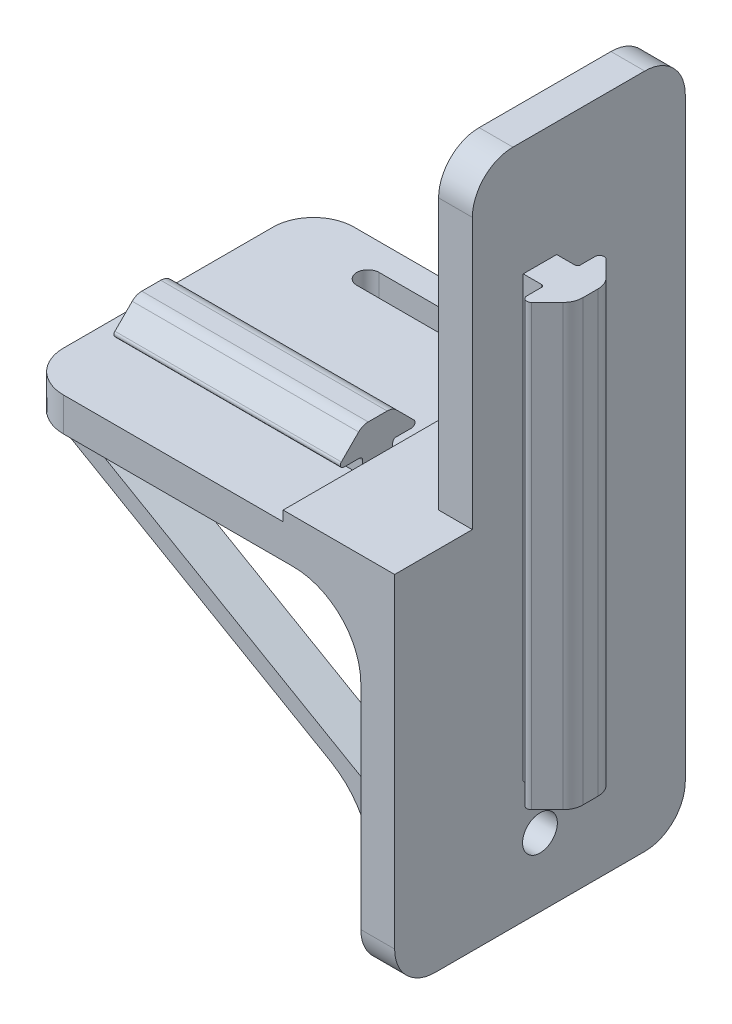
from build123d import *

# Parameters (mm, degrees)
BOSS_EXTRUDE5_DEPTH  = 50
SKETCH11_W           = 43
SKETCH11_H           = 100
BOSS_EXTRUDE6_DEPTH  = 5
BOSS_EXTRUDE8_DEPTH  = 55
SKETCH13_W           = 11.5
SKETCH13_H           = 47.5
CUT_EXTRUDE1_DEPTH   = 55
BOSS_EXTRUDE9_DEPTH  = 6
FILLET7_R            = 12
FILLET7_OF_MIRROR1_R = 12
FILLET8_R            = 6
BOSS_EXTRUDE10_START = 8
BOSS_EXTRUDE10_DEPTH = 8
FILLET12_R           = 10
BOSS_EXTRUDE11_DEPTH = 57
SKETCH16_R           = 2.575
CUT_EXTRUDE2_DEPTH   = 10
SKETCH17_W           = 27.480150942
SKETCH17_H           = 1.5
BOSS_EXTRUDE12_DEPTH = 11.5
SKETCH18_W           = 11.5
SKETCH18_H           = 1.5
BOSS_EXTRUDE13_DEPTH = 5
BOSS_EXTRUDE15_START = -5
BOSS_EXTRUDE15_DEPTH = 33.5
CUT_EXTRUDE3_DEPTH   = 6


with BuildPart() as part:
    # Sketch9 → Boss-Extrude5 (new body)
    with BuildSketch(Plane(origin=(0, 245, 0), x_dir=(1, 0, 0), z_dir=(0, 1, 0))):
        with BuildLine():
            Line((389.629800237, -111.599739584), (387.629800237, -111.599739584))
            Line((387.629800237, -111.599739584), (387.629800237, -106.649739584))
            Line((387.629800237, -106.649739584), (389.629800237, -106.649739584))
            Line((389.629800237, -106.649739584), (390.329799474, -106.649739584))
            ThreePointArc((390.329799474, -106.649739584), (390.605571069, -106.535511279), (390.719799474, -106.259739725))
            Line((390.719799474, -106.259739725), (390.719800256, -104.090618139))
            ThreePointArc((390.719800256, -104.090618139), (391.145748802, -103.453141463), (391.897703935, -103.602714709))
            Line((391.897703935, -103.602714709), (394.237480965, -105.942491739))
            ThreePointArc((394.237480965, -105.942491739), (394.868289671, -106.886563682), (395.089800232, -108.000172467))
            Line((395.089800232, -108.000172467), (395.089800237, -110.249306685))
            ThreePointArc((395.089800237, -110.249306685), (394.868289678, -111.362915477), (394.23748097, -112.306987424))
            Line((394.23748097, -112.306987424), (391.897703941, -114.646764454))
            ThreePointArc((391.897703941, -114.646764454), (391.145748809, -114.7963377), (390.719800262, -114.158861025))
            Line((390.719800262, -114.158861025), (390.719799474, -111.989739443))
            ThreePointArc((390.719799474, -111.989739443), (390.605571069, -111.71396789), (390.329799474, -111.599739584))
            Line((390.329799474, -111.599739584), (389.629800237, -111.599739584))
        make_face()
    extrude(amount=-BOSS_EXTRUDE5_DEPTH)

    # Sketch11 → Boss-Extrude6 (add)
    with BuildSketch(Plane.ZY.offset(-387.629800242)):
        with Locations((109.124739584, 220)):
            Rectangle(SKETCH11_W, SKETCH11_H)
    extrude(amount=BOSS_EXTRUDE6_DEPTH)

    # Sketch12 → Boss-Extrude8 (add)
    with BuildSketch(Plane.ZY.offset(-387.629800242)):
        Polygon((130.624739584, 222.5), (89.124739584, 222.5), (87.624739584, 222.5), (87.624739584, 217.5), (89.124739584, 217.5), (130.624739584, 217.5), align=None)
    extrude(amount=BOSS_EXTRUDE8_DEPTH)

    # Sketch13 → Cut-Extrude1 (cut)
    with BuildSketch(Plane.ZY.offset(-387.629800242)):
        with Locations((124.874739584, 246.25)):
            Rectangle(SKETCH13_W, SKETCH13_H)
    extrude(amount=CUT_EXTRUDE1_DEPTH, mode=Mode.SUBTRACT)

    # Sketch15 → Boss-Extrude9 (add)
    with BuildSketch(Plane.XY.offset(129.124739584)):
        Polygon((335.629800242, 217.5), (382.629800242, 190.364537348), (382.629800242, 193.251288694), (340.629800242, 217.5), align=None)
    boss_extrude9 = extrude(amount=-BOSS_EXTRUDE9_DEPTH)

    # Fillet7
    # the kernel refuses this fillet: 12 mm, written as the material it adds along each edge
    with BuildSketch(Plane(origin=(335.629800242, 217.5, 129.124739584), x_dir=(-1, 0, 0), z_dir=(0, 0, -1))) as fillet7_piece_1:
        with BuildLine():
            CenterArc((3.218847051, -11.998004249), FILLET7_R, 91.044975628, 28.955024372)
            Line((-2.781152949, -1.605699404), (-2.901152949, -1.397853307))
            Line((-2.901152949, -1.397853307), (-0.12, 0.207846097))
            Line((-0.12, 0.207846097), (0, 0.24))
            ThreePointArc((0, 0.24), (1.5, 0.24), (2.995623059, 0.239960085))
            Line((2.995623059, 0.239960085), (3, 0))
        make_face()
    extrude(amount=6)
    with BuildSketch(Plane(origin=(382.629800242, 190.364537348, 129.124739584), x_dir=(0, -1, 0), z_dir=(0, 0, -1))) as fillet7_piece_2:
        with BuildLine():
            CenterArc((FILLET7_R * 0.57735026919, FILLET7_R), FILLET7_R, 210, 60)
            Line((-FILLET7_R * 0.288675134595, FILLET7_R * 0.5), (-FILLET7_R * 0.305995642671, FILLET7_R * 0.49))
            Line((-FILLET7_R * 0.305995642671, FILLET7_R * 0.49), (-FILLET7_R * 0.0115470053838, -FILLET7_R * 0.02))
            Line((-FILLET7_R * 0.0115470053838, -FILLET7_R * 0.02), (FILLET7_R * 0.57735026919, -FILLET7_R * 0.02))
            Line((FILLET7_R * 0.57735026919, -FILLET7_R * 0.02), (FILLET7_R * 0.57735026919, 0))
        make_face()
    extrude(amount=6)

    # Mirror1: Boss-Extrude9 across plane
    add(boss_extrude9.mirror(Plane.XY.offset(110.624739584)))

    # Fillet7 of Mirror1
    # the kernel refuses this fillet: 12 mm, written as the material it adds along each edge
    with BuildSketch(Plane(origin=(335.629800242, 217.5, 92.124739584), x_dir=(-1, 0, 0), z_dir=(0, 0, 1))) as fillet7_of_mirror1_piece_1:
        with BuildLine():
            CenterArc((3.218847051, 11.998004249), FILLET7_OF_MIRROR1_R, 240, 28.955024372)
            Line((-2.781152949, 1.605699404), (-2.901152949, 1.397853307))
            Line((-2.901152949, 1.397853307), (-0.12, -0.207846097))
            Line((-0.12, -0.207846097), (0, -0.24))
            ThreePointArc((0, -0.24), (1.5, -0.24), (2.995623059, -0.239960085))
            Line((2.995623059, -0.239960085), (3, 0))
        make_face()
    extrude(amount=6)
    with BuildSketch(Plane(origin=(382.629800242, 190.364537348, 92.124739584), x_dir=(0, -1, 0), z_dir=(0, 0, 1))) as fillet7_of_mirror1_piece_2:
        with BuildLine():
            CenterArc((FILLET7_OF_MIRROR1_R * 0.57735026919, -FILLET7_OF_MIRROR1_R), FILLET7_OF_MIRROR1_R, 90, 60)
            Line((-FILLET7_OF_MIRROR1_R * 0.288675134595, -FILLET7_OF_MIRROR1_R * 0.5), (-FILLET7_OF_MIRROR1_R * 0.305995642671, -FILLET7_OF_MIRROR1_R * 0.49))
            Line((-FILLET7_OF_MIRROR1_R * 0.305995642671, -FILLET7_OF_MIRROR1_R * 0.49), (-FILLET7_OF_MIRROR1_R * 0.0115470053838, FILLET7_OF_MIRROR1_R * 0.02))
            Line((-FILLET7_OF_MIRROR1_R * 0.0115470053838, FILLET7_OF_MIRROR1_R * 0.02), (FILLET7_OF_MIRROR1_R * 0.57735026919, FILLET7_OF_MIRROR1_R * 0.02))
            Line((FILLET7_OF_MIRROR1_R * 0.57735026919, FILLET7_OF_MIRROR1_R * 0.02), (FILLET7_OF_MIRROR1_R * 0.57735026919, 0))
        make_face()
    extrude(amount=6)

    # Fillet8
    # the kernel refuses this fillet: 6 mm, written as the material it takes off along each edge
    with BuildSketch(Plane(origin=(402.629800242, 270, 87.624739584), x_dir=(0, 0, 1), z_dir=(-1, 0, 0)), Plane(origin=(332.629800242, 237.5, 87.624739584), x_dir=(0, 0, 1), z_dir=(0, -1, 0)), Plane(origin=(402.629800242, 270, 119.124739584), x_dir=(0, -1, 0), z_dir=(-1, 0, 0))) as fillet8_piece_1:
        with BuildLine():
            CenterArc((FILLET8_R, -FILLET8_R), FILLET8_R, 90, 90)
            Line((0, -FILLET8_R), (0, 0))
            Line((0, 0), (FILLET8_R, 0))
        make_face()
    extrude(amount=35, mode=Mode.SUBTRACT)
    with BuildSketch(Plane(origin=(402.629800242, 170, 87.624739584), x_dir=(0, 0, 1), z_dir=(-1, 0, 0)), Plane(origin=(402.629800242, 170, 130.624739584), x_dir=(0, 1, 0), z_dir=(-1, 0, 0)), Plane(origin=(332.629800242, 202.5, 130.624739584), x_dir=(1, 0, 0), z_dir=(0, 1, 0))) as fillet8_piece_2:
        with BuildLine():
            CenterArc((FILLET8_R, FILLET8_R), FILLET8_R, 180, 90)
            Line((0, FILLET8_R), (0, 0))
            Line((0, 0), (FILLET8_R, 0))
        make_face()
    extrude(amount=35, mode=Mode.SUBTRACT)

    # Sketch9<2> → Boss-Extrude10 (add)
    with BuildSketch(Plane(origin=(0, 245, 0), x_dir=(1, 0, 0), z_dir=(0, 1, 0)).offset(BOSS_EXTRUDE10_START)):
        with BuildLine():
            Line((389.629800237, -111.599739584), (387.629800237, -111.599739584))
            Line((387.629800237, -111.599739584), (387.629800237, -106.649739584))
            Line((387.629800237, -106.649739584), (389.629800237, -106.649739584))
            Line((389.629800237, -106.649739584), (390.329799474, -106.649739584))
            ThreePointArc((390.329799474, -106.649739584), (390.605571069, -106.535511279), (390.719799474, -106.259739725))
            Line((390.719799474, -106.259739725), (390.719800256, -104.090618139))
            ThreePointArc((390.719800256, -104.090618139), (391.145748802, -103.453141463), (391.897703935, -103.602714709))
            Line((391.897703935, -103.602714709), (394.237480965, -105.942491739))
            ThreePointArc((394.237480965, -105.942491739), (394.868289671, -106.886563682), (395.089800232, -108.000172467))
            Line((395.089800232, -108.000172467), (395.089800237, -110.249306685))
            ThreePointArc((395.089800237, -110.249306685), (394.868289678, -111.362915477), (394.23748097, -112.306987424))
            Line((394.23748097, -112.306987424), (391.897703941, -114.646764454))
            ThreePointArc((391.897703941, -114.646764454), (391.145748809, -114.7963377), (390.719800262, -114.158861025))
            Line((390.719800262, -114.158861025), (390.719799474, -111.989739443))
            ThreePointArc((390.719799474, -111.989739443), (390.605571069, -111.71396789), (390.329799474, -111.599739584))
            Line((390.329799474, -111.599739584), (389.629800237, -111.599739584))
        make_face()
    extrude(amount=-BOSS_EXTRUDE10_DEPTH)

    # Fillet12
    fillet12_edges = [part.edges().sort_by_distance(p)[0] for p in [
        (382.629800242, 217.5, 109.124739584),
    ]]
    fillet(fillet12_edges, radius=FILLET12_R)

    # Sketch9<3> → Boss-Extrude11 (add)
    with BuildSketch(Plane(origin=(0, 245, 0), x_dir=(1, 0, 0), z_dir=(0, 1, 0))):
        with BuildLine():
            Line((389.629800237, -111.599739584), (387.629800237, -111.599739584))
            Line((387.629800237, -111.599739584), (387.629800237, -106.649739584))
            Line((387.629800237, -106.649739584), (389.629800237, -106.649739584))
            Line((389.629800237, -106.649739584), (390.329799474, -106.649739584))
            ThreePointArc((390.329799474, -106.649739584), (390.605571069, -106.535511279), (390.719799474, -106.259739725))
            Line((390.719799474, -106.259739725), (390.719800256, -104.090618139))
            ThreePointArc((390.719800256, -104.090618139), (391.145748802, -103.453141463), (391.897703935, -103.602714709))
            Line((391.897703935, -103.602714709), (394.237480965, -105.942491739))
            ThreePointArc((394.237480965, -105.942491739), (394.868289671, -106.886563682), (395.089800232, -108.000172467))
            Line((395.089800232, -108.000172467), (395.089800237, -110.249306685))
            ThreePointArc((395.089800237, -110.249306685), (394.868289678, -111.362915477), (394.23748097, -112.306987424))
            Line((394.23748097, -112.306987424), (391.897703941, -114.646764454))
            ThreePointArc((391.897703941, -114.646764454), (391.145748809, -114.7963377), (390.719800262, -114.158861025))
            Line((390.719800262, -114.158861025), (390.719799474, -111.989739443))
            ThreePointArc((390.719799474, -111.989739443), (390.605571069, -111.71396789), (390.329799474, -111.599739584))
            Line((390.329799474, -111.599739584), (389.629800237, -111.599739584))
        make_face()
    extrude(amount=-BOSS_EXTRUDE11_DEPTH)

    # Sketch16 → Cut-Extrude2 (cut)
    with BuildSketch(Plane.ZY.offset(-382.629800242)):
        with Locations((109.124739584, 180.133064736)):
            Circle(SKETCH16_R)
    extrude(amount=-CUT_EXTRUDE2_DEPTH, mode=Mode.SUBTRACT)

    # Sketch17 → Boss-Extrude12 (add)
    with BuildSketch(Plane(origin=(371.129800242, 0, 0), x_dir=(0, 0, -1), z_dir=(1, 0, 0))):
        with Locations((-116.884664113, 223.25)):
            Rectangle(SKETCH17_W, SKETCH17_H)
    extrude(amount=BOSS_EXTRUDE12_DEPTH)

    # Sketch18 → Boss-Extrude13 (add)
    with BuildSketch(Plane(origin=(382.629800242, 0, 0), x_dir=(0, 0, -1), z_dir=(1, 0, 0))):
        with Locations((-124.874739584, 223.25)):
            Rectangle(SKETCH18_W, SKETCH18_H)
    extrude(amount=BOSS_EXTRUDE13_DEPTH)

    # Sketch22 → Boss-Extrude15 (add)
    with BuildSketch(Plane.ZY.offset(-332.629800242).offset(BOSS_EXTRUDE15_START)):
        with BuildLine():
            Line((114.406150208, 222.5), (114.406150208, 224.5))
            ThreePointArc((114.406150208, 224.5), (114.259703598, 224.853553391), (113.906150208, 225))
            Line((113.906150208, 225), (111.613256989, 225))
            ThreePointArc((111.613256989, 225), (111.151317223, 225.308658284), (111.259703598, 225.853553391))
            Line((111.259703598, 225.853553391), (113.82036377, 228.414213562))
            ThreePointArc((113.82036377, 228.414213562), (114.469210468, 228.847759065), (115.234577333, 229))
            Line((115.234577333, 229), (116.634664113, 229))
            Line((116.634664113, 229), (118.034750894, 229))
            ThreePointArc((118.034750894, 229), (118.800117758, 228.847759065), (119.448964456, 228.414213562))
            Line((119.448964456, 228.414213562), (122.009624628, 225.853553391))
            ThreePointArc((122.009624628, 225.853553391), (122.118011003, 225.308658284), (121.656071237, 225))
            Line((121.656071237, 225), (119.363178018, 225))
            ThreePointArc((119.363178018, 225), (119.009624628, 224.853553391), (118.863178018, 224.5))
            Line((118.863178018, 224.5), (118.863178018, 222.5))
            Line((118.863178018, 222.5), (114.406150208, 222.5))
        make_face()
    extrude(amount=-BOSS_EXTRUDE15_DEPTH)

    # Sketch23 → Cut-Extrude3 (cut)
    with BuildSketch(Plane(origin=(0, 222.5, 0), x_dir=(1, 0, 0), z_dir=(0, 1, 0))):
        with BuildLine():
            Line((346.279800242, -91.576720164), (374.979800242, -91.576720164))
            ThreePointArc((374.979800242, -91.576720164), (376.629800242, -93.226720164), (374.979800242, -94.876720164))
            Line((374.979800242, -94.876720164), (346.279800242, -94.876720164))
            ThreePointArc((346.279800242, -94.876720164), (344.629800242, -93.226720164), (346.279800242, -91.576720164))
        make_face()
    extrude(amount=-CUT_EXTRUDE3_DEPTH, mode=Mode.SUBTRACT)


solid = part.part
